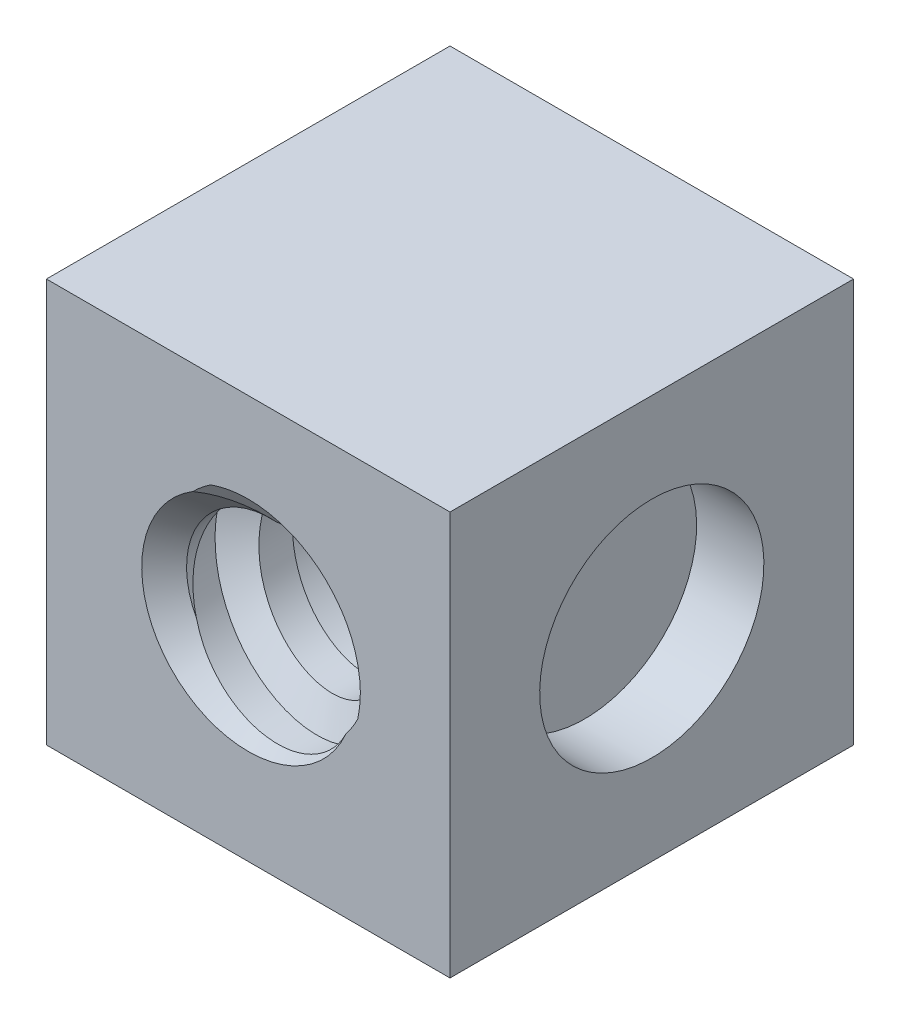
from build123d import *

# Parameters (mm, degrees)
SKETCH1_W           = 18
SKETCH1_H           = 18
SKETCH1_R           = 3.75
BOSS_EXTRUDE1_DEPTH = 18
SKETCH2_R           = 5
CUT_EXTRUDE1_DEPTH  = 3
CUT_SWEEP2_PITCH    = 4.44
CHAMFER1_SIZE       = 1
CHAMFER2_SIZE       = 1


with BuildPart() as part:
    # Sketch1 → Boss-Extrude1 (new body)
    with BuildSketch(Plane.XY):
        Rectangle(SKETCH1_W, SKETCH1_H)
        Circle(SKETCH1_R, mode=Mode.SUBTRACT)
    extrude(amount=BOSS_EXTRUDE1_DEPTH)

    # Sketch2 → Cut-Extrude1 (cut)
    with BuildSketch(Plane(origin=(9, 0, 0), x_dir=(0, 0, -1), z_dir=(1, 0, 0))):
        with Locations(Location((-9, 0, 0), (0, 0, 90))):
            Circle(SKETCH2_R)
    cut_extrude1 = extrude(amount=-CUT_EXTRUDE1_DEPTH, mode=Mode.SUBTRACT)

    # Mirror1: Cut-Extrude1 across plane
    add(cut_extrude1.mirror(Plane(origin=(0, 0, 0), x_dir=(0, 0, 1), z_dir=(1, 0, 0))), mode=Mode.SUBTRACT)

    # Cut-Sweep2: the profile of Sketch3 profile screwed along a right-hand helix of 4.954955 turns, 12 arcs to a turn; built about Z, then put on its axis
    cut_sweep2_z = Axis((0, 0, 0), (0, 0, 1))
    cut_sweep2_corners = [(0, 5, -2.221687836), (0, 3.7497, -2.943548878), (0, 3.7497, 0.000173205), (0, 5, -0.721687836)]
    with BuildLine(mode=Mode.PRIVATE) as cut_sweep2_profile:
        Line(cut_sweep2_corners[0], cut_sweep2_corners[1])
        Line(cut_sweep2_corners[1], cut_sweep2_corners[2])
        Line(cut_sweep2_corners[2], cut_sweep2_corners[3])
        Line(cut_sweep2_corners[3], cut_sweep2_corners[0])
    cut_sweep2_cap = Face(cut_sweep2_profile.wire())
    cut_sweep2_turn_angles = [0, 15, 30, 45, 60, 75, 90, 105, 120, 135, 150, 165, 180, 195, 210, 225, 240, 255, 270, 285, 300, 315, 330, 345, 360]
    cut_sweep2_turn_weights = [1, 0.9659258262890683, 1, 0.9659258262890683, 1, 0.9659258262890683, 1, 0.9659258262890683, 1, 0.9659258262890683, 1, 0.9659258262890683, 1, 0.9659258262890683, 1, 0.9659258262890683, 1, 0.9659258262890683, 1, 0.9659258262890683, 1, 0.9659258262890683, 1, 0.9659258262890683, 1]
    cut_sweep2_turn_rails = [Edge.make_bspline([Vector(p[0], p[1], 0).rotate(cut_sweep2_z, cut_sweep2_turn_angles[k]) / cut_sweep2_turn_weights[k] + Vector(0, 0, p[2] + CUT_SWEEP2_PITCH * cut_sweep2_turn_angles[k] / 360) for k in range(25)], [0, 0, 0, 1, 1, 2, 2, 3, 3, 4, 4, 5, 5, 6, 6, 7, 7, 8, 8, 9, 9, 10, 10, 11, 11, 12, 12, 12], 2, cut_sweep2_turn_weights) for p in cut_sweep2_corners]
    cut_sweep2_turn_sides = [Face.make_surface_from_curves(cut_sweep2_turn_rails[p[0]], cut_sweep2_turn_rails[p[1]]) for p in [(0, 1), (1, 2), (2, 3), (3, 0)]]
    cut_sweep2_last_angles = [1440, 1455, 1470, 1485, 1500, 1515, 1530, 1545, 1560, 1575, 1590, 1605, 1620, 1635, 1650, 1665, 1680, 1695, 1710, 1725, 1740, 1755, 1770, 1776.891891892, 1783.783783784]
    cut_sweep2_last_weights = [1, 0.9659258262890683, 1, 0.9659258262890683, 1, 0.9659258262890683, 1, 0.9659258262890683, 1, 0.9659258262890683, 1, 0.9659258262890683, 1, 0.9659258262890683, 1, 0.9659258262890683, 1, 0.9659258262890683, 1, 0.9659258262890683, 1, 0.9659258262890683, 1, 0.9927743329353277, 1]
    cut_sweep2_last_rails = [Edge.make_bspline([Vector(p[0], p[1], 0).rotate(cut_sweep2_z, cut_sweep2_last_angles[k]) / cut_sweep2_last_weights[k] + Vector(0, 0, p[2] + CUT_SWEEP2_PITCH * cut_sweep2_last_angles[k] / 360) for k in range(25)], [0, 0, 0, 1, 1, 2, 2, 3, 3, 4, 4, 5, 5, 6, 6, 7, 7, 8, 8, 9, 9, 10, 10, 11, 11, 12, 12, 12], 2, cut_sweep2_last_weights) for p in cut_sweep2_corners]
    cut_sweep2_last_sides = [Face.make_surface_from_curves(cut_sweep2_last_rails[p[0]], cut_sweep2_last_rails[p[1]]) for p in [(0, 1), (1, 2), (2, 3), (3, 0)]]
    cut_sweep2 = Plane(origin=(0, 0, 0), x_dir=(-1, 0, 0), z_dir=(0, 0, 1)) * Solid(Shell([*[p.moved(Location((0, 0, CUT_SWEEP2_PITCH * i))) for i in range(4) for p in cut_sweep2_turn_sides], *cut_sweep2_last_sides, cut_sweep2_cap, cut_sweep2_cap.rotate(cut_sweep2_z, 1783.783783784).moved(Location((0, 0, CUT_SWEEP2_PITCH * 1783.783783784 / 360)))]))
    add(cut_sweep2, mode=Mode.SUBTRACT)

    # Chamfer1
    chamfer1_edges = [part.edges().sort_by_distance(p)[0] for p in [
        (-2.472776759, -2.819197599, 18),
    ]]
    chamfer(chamfer1_edges, length=CHAMFER1_SIZE)

    # Chamfer2
    chamfer2_edges = [part.edges().sort_by_distance(p)[0] for p in [
        (-3.269863985, -1.835889299, 0),
    ]]
    chamfer(chamfer2_edges, length=CHAMFER2_SIZE)


solid = part.part
